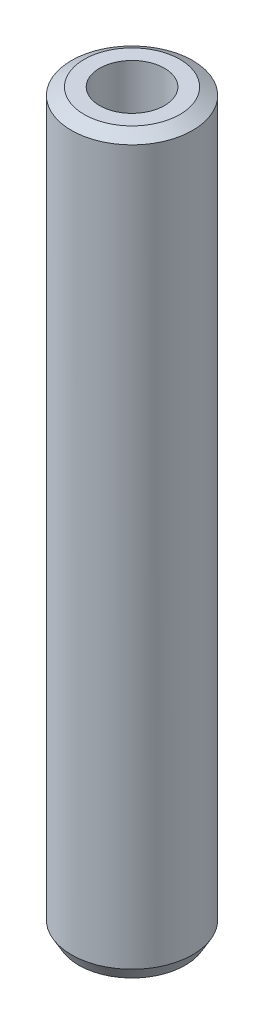
from build123d import *
from OCP.BRepFilletAPI import BRepFilletAPI_MakeChamfer

# Parameters (mm, degrees)
SKETCH1_R           = 10
BOSS_EXTRUDE1_DEPTH = 121.130850773
SKETCH2_R           = 5.352040264
CUT_EXTRUDE1_DEPTH  = 122.95361007
CHAMFER1_SIZE       = 1.21796565
CHAMFER1_SIZE2      = 2.109578387


with BuildPart() as part:
    # Sketch1 → Boss-Extrude1 (new body)
    with BuildSketch(Plane(origin=(0, 0, 0), x_dir=(1, 0, 0), z_dir=(0, 1, 0))):
        Circle(SKETCH1_R)
    extrude(amount=BOSS_EXTRUDE1_DEPTH)

    # Sketch2 → Cut-Extrude1 (cut, through all)
    with BuildSketch(Plane(origin=(0, 0, 0), x_dir=(1, 0, 0), z_dir=(0, 1, 0))):
        Circle(SKETCH2_R)
    extrude(amount=CUT_EXTRUDE1_DEPTH, mode=Mode.SUBTRACT)

    # Chamfer1: one chamfer whose edges measure the first distance from different faces: ONE call of the kernel's chamfer builder (chamfer() names one face for all edges)
    chamfer1_edges_1 = [part.edges().sort_by_distance(p)[0] for p in [
        (-10, 121.130850773, 0),
    ]]
    chamfer1_side_1 = [part.faces().sort_by_distance(p)[0] for p in [
        (-10, 60.565425387, 0),
    ]]
    chamfer1_edges_2 = [part.edges().sort_by_distance(p)[0] for p in [
        (-10, 0, 0),
    ]]
    chamfer1_side_2 = [part.faces().sort_by_distance(p)[0] for p in [
        (-9.717157288, 0, 0),
    ]]
    chamfer1 = BRepFilletAPI_MakeChamfer(part.part.solid().wrapped)
    for e in chamfer1_edges_1:
        chamfer1.Add(CHAMFER1_SIZE, CHAMFER1_SIZE2, e.wrapped, chamfer1_side_1[0].wrapped)  # the first distance lies on this face
    for e in chamfer1_edges_2:
        chamfer1.Add(CHAMFER1_SIZE, CHAMFER1_SIZE2, e.wrapped, chamfer1_side_2[0].wrapped)  # the first distance lies on this face
    add(Compound.cast(chamfer1.Shape()), mode=Mode.REPLACE)


solid = part.part
